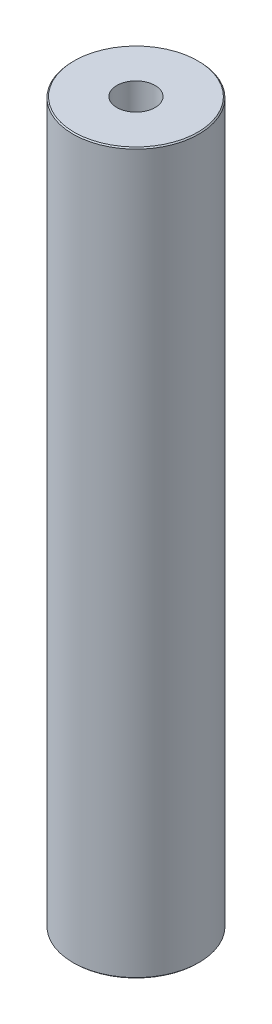
from build123d import *

# Parameters (mm, degrees)
SKETCH1_R           = 52.5
BOSS_EXTRUDE1_DEPTH = 600
SKETCH2_R           = 15.977132052
CUT_EXTRUDE1_DEPTH  = 605.576297914
CHAMFER1_SIZE       = 0.935563746


with BuildPart() as part:
    # Sketch1 → Boss-Extrude1 (new body)
    with BuildSketch(Plane(origin=(0, 0, 0), x_dir=(1, 0, 0), z_dir=(0, 1, 0))):
        Circle(SKETCH1_R)
    extrude(amount=BOSS_EXTRUDE1_DEPTH)

    # Sketch2 → Cut-Extrude1 (cut, through all)
    with BuildSketch(Plane(origin=(0, 0, 0), x_dir=(1, 0, 0), z_dir=(0, 1, 0))):
        Circle(SKETCH2_R)
    extrude(amount=CUT_EXTRUDE1_DEPTH, mode=Mode.SUBTRACT)

    # Chamfer1
    chamfer1_edges = [part.edges().sort_by_distance(p)[0] for p in [
        (-52.5, 600, 0),
        (-52.5, 0, 0),
    ]]
    chamfer(chamfer1_edges, length=CHAMFER1_SIZE)


solid = part.part
